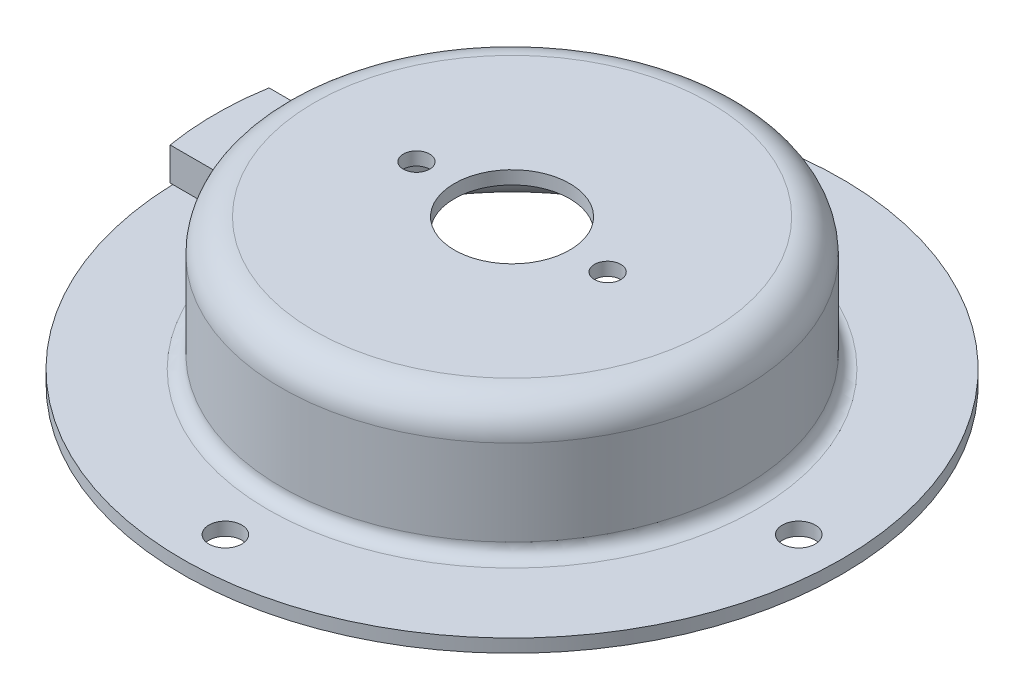
from build123d import *

# Parameters (mm, degrees)
CUT_EXTRUDE1_REACH       = 76.054
SKETCH2_R                = 2
SKETCH2_R_2              = 8.75
CUT_EXTRUDE2_REACH       = 75.485
CUT_EXTRUDE2_END_RADIUS  = 35
SKETCH3_W                = 15
SKETCH3_H                = 5
EXTRUDE_THIN1_REACH      = 75.485
EXTRUDE_THIN1_END_RADIUS = 45
SKETCH3_2_W              = 15
SKETCH3_2_H              = 5
SKETCH3_2_W_2            = 13
SKETCH3_2_H_2            = 3
CUT_EXTRUDE3_START       = -5
CUT_EXTRUDE3_DEPTH       = 5
SKETCH5_R                = 2.5
CUT_EXTRUDE4_DEPTH       = 74.484692283


with BuildPart() as part:
    # Sketch1 → Revolve-Thin1 (revolve)
    with BuildSketch(Plane.XY):
        with BuildLine():
            Line((0, 20), (30, 20))
            ThreePointArc((30, 20), (33.535533906, 18.535533906), (35, 15))
            Line((35, 15), (35, 2))
            ThreePointArc((35, 2), (35.585786438, 0.585786438), (37, 0))
            Line((37, 0), (50, 0))
            Line((50, 0), (50, -2))
            Line((50, -2), (37, -2))
            ThreePointArc((37, -2), (34.171572875, -0.828427125), (33, 2))
            Line((33, 2), (33, 15))
            ThreePointArc((33, 15), (32.121320344, 17.121320344), (30, 18))
            Line((30, 18), (0, 18))
            Line((0, 18), (0, 20))
        make_face()
    revolve(axis=Axis((0, -881.36101513, 0), (0, 1, 0)))

    # Sketch2 → Cut-Extrude1 (cut, up to next)
    with BuildSketch(Plane(origin=(0, 20, 0), x_dir=(1, 0, 0), z_dir=(0, 1, 0)), mode=Mode.PRIVATE) as cut_extrude1_sk1:
        with Locations(Location((14.5, 0, 0), (0, 0, 180))):
            Circle(SKETCH2_R)
    cut_extrude1_tool1 = extrude(cut_extrude1_sk1.sketch, amount=-CUT_EXTRUDE1_REACH, mode=Mode.PRIVATE) & part.part
    # Sketch2 → Cut-Extrude1 (cut, up to next)
    with BuildSketch(Plane(origin=(0, 20, 0), x_dir=(1, 0, 0), z_dir=(0, 1, 0)), mode=Mode.PRIVATE) as cut_extrude1_sk2:
        with Locations(Location((-14.5, 0, 0), (0, 0, 180))):
            Circle(SKETCH2_R)
    cut_extrude1_tool2 = extrude(cut_extrude1_sk2.sketch, amount=-CUT_EXTRUDE1_REACH, mode=Mode.PRIVATE) & part.part
    # Sketch2 → Cut-Extrude1 (cut, up to next)
    with BuildSketch(Plane(origin=(0, 20, 0), x_dir=(1, 0, 0), z_dir=(0, 1, 0)), mode=Mode.PRIVATE) as cut_extrude1_sk3:
        with Locations(Location((0, 0, 0), (0, 0, 180))):
            Circle(SKETCH2_R_2)
    cut_extrude1_tool3 = extrude(cut_extrude1_sk3.sketch, amount=-CUT_EXTRUDE1_REACH, mode=Mode.PRIVATE) & part.part
    add(cut_extrude1_tool1.solids().sort_by_distance((14.5, 20, 0))[0], mode=Mode.SUBTRACT)
    add(cut_extrude1_tool2.solids().sort_by_distance((-14.5, 20, 0))[0], mode=Mode.SUBTRACT)
    add(cut_extrude1_tool3.solids().sort_by_distance((0, 20, 0))[0], mode=Mode.SUBTRACT)

    # Cut-Extrude2: up to this cylinder (the profile starts inside it)
    cut_extrude2_end = Plane(origin=(0, 8.5, 0), z_dir=(0, -1, 0)) * Cylinder(CUT_EXTRUDE2_END_RADIUS, 221.97, mode=Mode.PRIVATE)
    # Sketch3 → Cut-Extrude2 (cut, up to the surface)
    with BuildSketch(Plane(origin=(0, 0, 0), x_dir=(0, 0, -1), z_dir=(1, 0, 0)), mode=Mode.PRIVATE) as cut_extrude2_sk1:
        with Locations((0, 8.5)):
            Rectangle(SKETCH3_W, SKETCH3_H)
    cut_extrude2_tool1 = extrude(cut_extrude2_sk1.sketch, amount=-CUT_EXTRUDE2_REACH, mode=Mode.PRIVATE) & cut_extrude2_end
    add(cut_extrude2_tool1.solids().sort_by_distance((0, 8.5, 0))[0], mode=Mode.SUBTRACT)

    # Sketch5 → Cut-Extrude4 (cut, through all)
    with BuildSketch(Plane(origin=(0, 0, 0), x_dir=(1, 0, 0), z_dir=(0, 1, 0))):
        with Locations(Location((0, 43.5, 0), (0, 0, 180))):
            Circle(SKETCH5_R)
        with Locations(Location((43.5, 0, 0), (0, 0, 180))):
            Circle(SKETCH5_R)
        with Locations(Location((0, -43.5, 0), (0, 0, 180))):
            Circle(SKETCH5_R)
        with Locations(Location((-43.5, 0, 0), (0, 0, 180))):
            Circle(SKETCH5_R)
    extrude(amount=-CUT_EXTRUDE4_DEPTH, mode=Mode.SUBTRACT)


with BuildPart() as body_2:
    # Extrude-Thin1: up to this cylinder (the profile starts inside it)
    extrude_thin1_end = Plane(origin=(0, 6.158114, 0), z_dir=(0, -1, 0)) * Cylinder(EXTRUDE_THIN1_END_RADIUS, 241.97, mode=Mode.PRIVATE)
    # Sketch3<2> → Extrude-Thin1 (new, up to the surface)
    with BuildSketch(Plane(origin=(0, 0, 0), x_dir=(0, 0, -1), z_dir=(1, 0, 0)), mode=Mode.PRIVATE) as extrude_thin1_sk1:
        with Locations((0, 8.5)):
            Rectangle(SKETCH3_2_W, SKETCH3_2_H)
        with Locations((0, 8.5)):
            Rectangle(SKETCH3_2_W_2, SKETCH3_2_H_2, mode=Mode.SUBTRACT)
    extrude_thin1_tool1 = extrude(extrude_thin1_sk1.sketch, amount=-EXTRUDE_THIN1_REACH, mode=Mode.PRIVATE) & extrude_thin1_end
    add(extrude_thin1_tool1.solids().sort_by_distance((0, 6.158114, 0))[0])

    # Sketch4 → Cut-Extrude3 (cut)
    with BuildSketch(Plane.XZ.offset(-6).offset(CUT_EXTRUDE3_START)):
        with BuildLine():
            Line((-32.136427928, -7.5), (0, -7.5))
            Line((0, -7.5), (0, 7.5))
            Line((0, 7.5), (-32.136427928, 7.5))
            ThreePointArc((-32.136427928, 7.5), (-33, 0), (-32.136427928, -7.5))
        make_face()
    extrude(amount=CUT_EXTRUDE3_DEPTH, mode=Mode.SUBTRACT)


solid = Compound([part.part, body_2.part])
